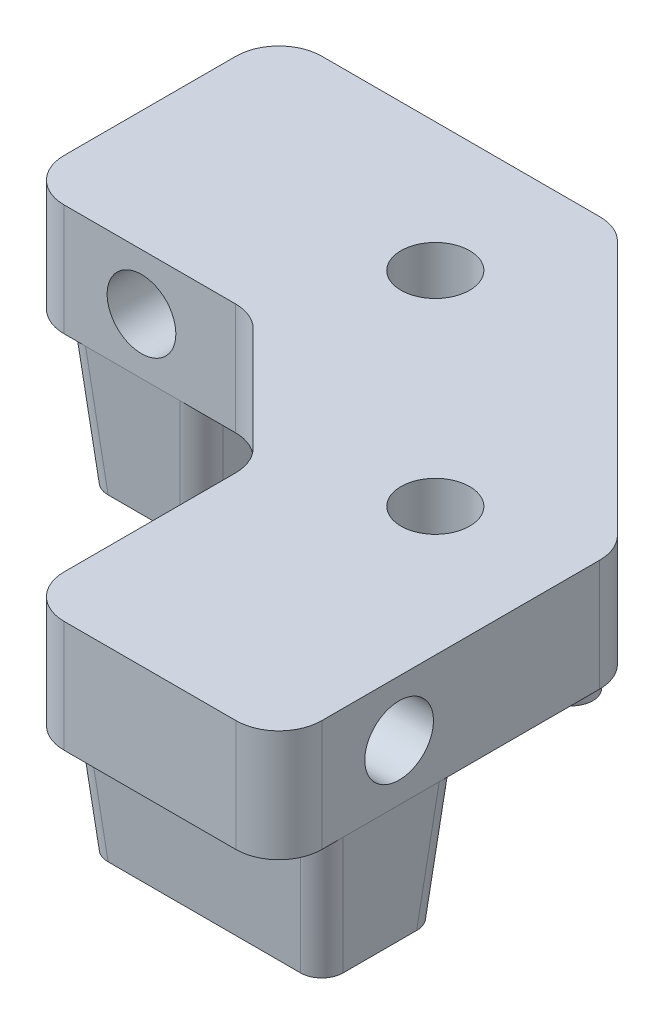
from build123d import *

# Parameters (mm, degrees)
SKETCH1_R                = 4
EXTRUDE1_DEPTH           = 13
FILLET5_R                = 5
SKETCH5_R                = 4
EXTRUDE5_DEPTH           = 30
SKETCH6_R                = 4
EXTRUDE6_DEPTH           = 30
SKETCH8_R                = 4
EXTRUDE7_DEPTH           = 30
SKETCH9_W                = 16
SKETCH9_H                = 30
EXTRUDE8_DEPTH           = 15
EXTRUDE8_DRAFT           = 5
EXTRUDE8_PROFILE_2_DEPTH = 15
EXTRUDE8_PROFILE_2_DRAFT = 5
EXTRUDE8_PROFILE_3_DEPTH = 15
EXTRUDE8_PROFILE_3_DRAFT = 5
FILLET8_R                = 2.5


with BuildPart() as part:
    # Sketch1 → Extrude1 (new body)
    with BuildSketch(Plane(origin=(0, 0, 0), x_dir=(1, 0, 0), z_dir=(0, 1, 0))):
        Polygon((0, -15), (-15, 0), (-42, 0), (-42, 30), (-2.573593129, 30), (30, -2.573593129), (30, -42), (0, -42), align=None)
        with Locations(Location((-8.786796564, 15, 0), (0, 0, 90))):
            Circle(SKETCH1_R, mode=Mode.SUBTRACT)
        with Locations(Location((15, -8.786796564, 0), (0, 0, 90))):
            Circle(SKETCH1_R, mode=Mode.SUBTRACT)
    extrude(amount=EXTRUDE1_DEPTH)

    # Fillet5
    fillet5_edges = [part.edges().sort_by_distance(p)[0] for p in [
        (-42, 6.5, 0),
        (-42, 6.5, -30),
        (-2.573593129, 6.5, -30),
        (30, 6.5, 2.573593129),
        (30, 6.5, 42),
        (0, 6.5, 42),
        (0, 6.5, 15),
        (-15, 6.5, 0),
    ]]
    fillet(fillet5_edges, radius=FILLET5_R)

    # Sketch5 → Extrude5 (cut)
    with BuildSketch(Plane(origin=(-7.5, 0, 7.5), x_dir=(0.7071067811865476, 0, 0.7071067811865476), z_dir=(-0.7071067811865476, 0, 0.7071067811865476))):
        with Locations((0, 6.5)):
            Circle(SKETCH5_R)
    extrude(amount=-EXTRUDE5_DEPTH, mode=Mode.SUBTRACT)

    # Sketch6 → Extrude6 (cut)
    with BuildSketch(Plane.XY):
        with Locations((-28, 6.5)):
            Circle(SKETCH6_R)
    extrude(amount=-EXTRUDE6_DEPTH, mode=Mode.SUBTRACT)

    # Sketch8 → Extrude7 (cut)
    with BuildSketch(Plane.ZY):
        with Locations((28, 6.5)):
            Circle(SKETCH8_R)
    extrude(amount=-EXTRUDE7_DEPTH, mode=Mode.SUBTRACT)


with BuildPart() as extrude8_tool:
    # Sketch9 → Extrude8 (with draft: the straight prism first)
    with BuildSketch(Plane.XZ):
        with Locations((-29, -15)):
            Rectangle(SKETCH9_W, SKETCH9_H)
    extrude(amount=EXTRUDE8_DEPTH)
    # Extrude8: the draft: its side faces are tilted about the plane it starts from
    extrude8_sides = [extrude8_tool.faces().sort_by_distance(p)[0] for p in [
        (-29, -7.5, -30),
        (-21, -7.5, -15),
        (-29, -7.5, 0),
        (-37, -7.5, -15),
    ]]
    draft(extrude8_sides, Plane.XZ, EXTRUDE8_DRAFT)


with BuildPart() as part_1:
    add(part.part)

    # Extrude8: add extrude8_tool
    add(extrude8_tool.part)


with BuildPart() as extrude8_profile_2_tool:
    # Sketch9 → Extrude8 profile 2 (with draft: the straight prism first)
    with BuildSketch(Plane.XZ):
        Polygon((18.662950904, -8.763455967), (-2.550252532, 12.449747468), (-12.449747468, 2.550252532), (8.763455967, -18.662950904), align=None)
    extrude(amount=EXTRUDE8_PROFILE_2_DEPTH)
    # Extrude8 profile 2: the draft: its side faces are tilted about the plane it starts from
    extrude8_profile_2_sides = [extrude8_profile_2_tool.faces().sort_by_distance(p)[0] for p in [
        (8.056349186, -7.5, 1.843145751),
        (-7.5, -7.5, 7.5),
        (-1.843145751, -7.5, -8.056349186),
        (13.713203436, -7.5, -13.713203436),
    ]]
    draft(extrude8_profile_2_sides, Plane.XZ, EXTRUDE8_PROFILE_2_DRAFT)


with BuildPart() as part_2:
    add(part_1.part)

    # Extrude8 profile 2: add extrude8_profile_2_tool
    add(extrude8_profile_2_tool.part)


with BuildPart() as extrude8_profile_3_tool:
    # Sketch9 → Extrude8 profile 3 (with draft: the straight prism first)
    with BuildSketch(Plane.XZ):
        Polygon((30, 37), (0, 37), (0, 21), (30, 20.82233047), align=None)
    extrude(amount=EXTRUDE8_PROFILE_3_DEPTH)
    # Extrude8 profile 3: the draft: its side faces are tilted about the plane it starts from
    extrude8_profile_3_sides = [extrude8_profile_3_tool.faces().sort_by_distance(p)[0] for p in [
        (15, -7.5, 37),
        (0, -7.5, 29),
        (15, -7.5, 20.911165235),
        (30, -7.5, 28.911165235),
    ]]
    draft(extrude8_profile_3_sides, Plane.XZ, EXTRUDE8_PROFILE_3_DRAFT)


with BuildPart() as part_3:
    add(part_2.part)

    # Extrude8 profile 3: add extrude8_profile_3_tool
    add(extrude8_profile_3_tool.part)

    # Fillet8
    # the kernel refuses this fillet: 2.5 mm, written as the material it takes off along each edge
    with BuildSketch(Plane(origin=(-13.211385745, 6.155764282, 2.550252532), x_dir=(0.6990853645605914, 0.08649619246092898, 0.7097873355780214), z_dir=(0.12279134661747972, -0.9924325091389671, 0))) as fillet8_piece_1_section:
        with BuildLine():
            CenterArc((FILLET8_R * 0.992432509139, -FILLET8_R), FILLET8_R, 90, 89.564769998)
            Line((-FILLET8_R * 0.00753863989878, -FILLET8_R * 0.992403876506), (0, 0))
            Line((0, 0), (FILLET8_R * 0.992432509139, 0))
        make_face()
    fillet8_piece_1 = extrude(amount=27.519784281, mode=Mode.PRIVATE)
    fillet8_piece_1 = split(fillet8_piece_1, bisect_by=Plane(origin=(-10.350961521, 0, 2.550252532), z_dir=(0, -1, 0)), keep=Keep.TOP, mode=Mode.PRIVATE)
    add(fillet8_piece_1, mode=Mode.SUBTRACT)
    with BuildSketch(Plane(origin=(-2.550252532, 6.155764282, 13.211385745), x_dir=(-0.7097873355780224, 0.08649619246092884, -0.6990853645605904), z_dir=(0, -0.9924325091389671, -0.12279134661747967))) as fillet8_piece_2_section:
        with BuildLine():
            CenterArc((FILLET8_R * 0.992432509139, FILLET8_R), FILLET8_R, 180.435230002, 89.564769998)
            Line((-FILLET8_R * 0.00753863989878, FILLET8_R * 0.992403876506), (0, 0))
            Line((0, 0), (FILLET8_R * 0.992432509139, 0))
        make_face()
    fillet8_piece_2 = extrude(amount=27.519784281, mode=Mode.PRIVATE)
    fillet8_piece_2 = split(fillet8_piece_2, bisect_by=Plane(origin=(-2.550252532, 0, 10.350961521), z_dir=(0, -1, 0)), keep=Keep.TOP, mode=Mode.PRIVATE)
    add(fillet8_piece_2, mode=Mode.SUBTRACT)
    with BuildSketch(Plane(origin=(-0.535427042, 6.119959098, 20.467734537), x_dir=(0.9962056349623634, 0.08598926801855533, -0.01342306428755091), z_dir=(0.0868304478214788, -0.9924765600716912, 0.08631773305285761))) as fillet8_piece_3_section:
        with BuildLine():
            CenterArc((FILLET8_R * 0.98661620345, FILLET8_R), FILLET8_R, 180.77198953, 89.22801047)
            Line((-FILLET8_R * 0.0132930268312, FILLET8_R * 0.986526648575), (0, 0))
            Line((0, 0), (FILLET8_R * 0.98661620345, 0))
        make_face()
    fillet8_piece_3 = extrude(amount=27.44640961, mode=Mode.PRIVATE)
    fillet8_piece_3 = split(fillet8_piece_3, bisect_by=Plane(origin=(1.478852111, 0, 22.470119813), z_dir=(0, -1, 0)), keep=Keep.TOP, mode=Mode.PRIVATE)
    add(fillet8_piece_3, mode=Mode.SUBTRACT)
    with BuildSketch(Plane(origin=(-0.53855959, 6.155764282, 37.53855959), x_dir=(-0.007567436278487758, 0.0864961924609277, -0.9962234400966146), z_dir=(0.08682659386424772, -0.9924325091389672, -0.08682659386424656))) as fillet8_piece_4_section:
        with BuildLine():
            CenterArc((FILLET8_R * 0.992432509139, FILLET8_R), FILLET8_R, 180.435230002, 89.564769998)
            Line((-FILLET8_R * 0.00753863989879, FILLET8_R * 0.992403876506), (0, 0))
            Line((0, 0), (FILLET8_R * 0.992432509139, 0))
        make_face()
    fillet8_piece_4 = extrude(amount=27.519784281, mode=Mode.PRIVATE)
    fillet8_piece_4 = split(fillet8_piece_4, bisect_by=Plane(origin=(1.484065776, 0, 35.515934224), z_dir=(0, -1, 0)), keep=Keep.TOP, mode=Mode.PRIVATE)
    add(fillet8_piece_4, mode=Mode.SUBTRACT)
    with BuildSketch(Plane(origin=(-37.53855959, 6.155764282, 0.53855959), x_dir=(0.9962234400966147, 0.08649619246092866, 0.00756743627848773), z_dir=(0.0868265938642475, -0.9924325091389671, -0.08682659386424771))) as fillet8_piece_5_section:
        with BuildLine():
            CenterArc((FILLET8_R * 0.992432509139, -FILLET8_R), FILLET8_R, 90, 89.564769998)
            Line((-FILLET8_R * 0.00753863989878, -FILLET8_R * 0.992403876506), (0, 0))
            Line((0, 0), (FILLET8_R * 0.992432509139, 0))
        make_face()
    fillet8_piece_5 = extrude(amount=27.519784281, mode=Mode.PRIVATE)
    fillet8_piece_5 = split(fillet8_piece_5, bisect_by=Plane(origin=(-35.515934224, 0, -1.484065776), z_dir=(0, -1, 0)), keep=Keep.TOP, mode=Mode.PRIVATE)
    add(fillet8_piece_5, mode=Mode.SUBTRACT)
    with BuildSketch(Plane(origin=(-37.53855959, 6.155764282, -30.53855959), x_dir=(0.9962234400966145, 0.08649619246092907, -0.007567436278487628), z_dir=(0.08682659386424792, -0.9924325091389671, 0.08682659386424772))) as fillet8_piece_6_section:
        with BuildLine():
            CenterArc((FILLET8_R * 0.992432509139, FILLET8_R), FILLET8_R, 180.435230002, 89.564769998)
            Line((-FILLET8_R * 0.00753863989877, FILLET8_R * 0.992403876506), (0, 0))
            Line((0, 0), (FILLET8_R * 0.992432509139, 0))
        make_face()
    fillet8_piece_6 = extrude(amount=27.519784281, mode=Mode.PRIVATE)
    fillet8_piece_6 = split(fillet8_piece_6, bisect_by=Plane(origin=(-35.515934224, 0, -28.515934224), z_dir=(0, -1, 0)), keep=Keep.TOP, mode=Mode.PRIVATE)
    add(fillet8_piece_6, mode=Mode.SUBTRACT)
    with BuildSketch(Plane(origin=(-20.46144041, 6.155764282, 0.53855959), x_dir=(0.007567436278484768, 0.08649619246092911, -0.9962234400966145), z_dir=(-0.0868265938642479, -0.9924325091389671, -0.08682659386424771))) as fillet8_piece_7_section:
        with BuildLine():
            CenterArc((FILLET8_R * 0.992432509139, -FILLET8_R), FILLET8_R, 90, 89.564769998)
            Line((-FILLET8_R * 0.00753863989877, -FILLET8_R * 0.992403876506), (0, 0))
            Line((0, 0), (FILLET8_R * 0.992432509139, 0))
        make_face()
    fillet8_piece_7 = extrude(amount=27.519784281, mode=Mode.PRIVATE)
    fillet8_piece_7 = split(fillet8_piece_7, bisect_by=Plane(origin=(-22.484065776, 0, -1.484065776), z_dir=(0, -1, 0)), keep=Keep.TOP, mode=Mode.PRIVATE)
    add(fillet8_piece_7, mode=Mode.SUBTRACT)
    with BuildSketch(Plane(origin=(8.763455967, 6.155764282, -19.42458918), x_dir=(-0.7097873355780235, 0.08649619246092868, 0.6990853645605893), z_dir=(0, -0.9924325091389671, 0.12279134661747969))) as fillet8_piece_8_section:
        with BuildLine():
            CenterArc((FILLET8_R * 0.992432509139, -FILLET8_R), FILLET8_R, 90, 89.564769998)
            Line((-FILLET8_R * 0.00753863989878, -FILLET8_R * 0.992403876506), (0, 0))
            Line((0, 0), (FILLET8_R * 0.992432509139, 0))
        make_face()
    fillet8_piece_8 = extrude(amount=27.519784281, mode=Mode.PRIVATE)
    fillet8_piece_8 = split(fillet8_piece_8, bisect_by=Plane(origin=(8.763455967, 0, -16.564164956), z_dir=(0, -1, 0)), keep=Keep.TOP, mode=Mode.PRIVATE)
    add(fillet8_piece_8, mode=Mode.SUBTRACT)
    with BuildSketch(Plane(origin=(30.53855959, 6.155764282, 37.53855959), x_dir=(0.0075674362784875545, 0.08649619246093003, -0.9962234400966146), z_dir=(-0.08682659386424771, -0.9924325091389671, -0.08682659386424886))) as fillet8_piece_9_section:
        with BuildLine():
            CenterArc((FILLET8_R * 0.992432509139, -FILLET8_R), FILLET8_R, 90, 89.564769998)
            Line((-FILLET8_R * 0.00753863989876, -FILLET8_R * 0.992403876506), (0, 0))
            Line((0, 0), (FILLET8_R * 0.992432509139, 0))
        make_face()
    fillet8_piece_9 = extrude(amount=27.519784281, mode=Mode.PRIVATE)
    fillet8_piece_9 = split(fillet8_piece_9, bisect_by=Plane(origin=(28.515934224, 0, 35.515934224), z_dir=(0, -1, 0)), keep=Keep.TOP, mode=Mode.PRIVATE)
    add(fillet8_piece_9, mode=Mode.SUBTRACT)
    with BuildSketch(Plane(origin=(30.541709896, 6.191772448, 20.277402896), x_dir=(-0.9962063107197006, 0.08700605966245174, -0.001712327146725053), z_dir=(-0.08682269450948527, -0.9923879393100855, 0.08733840867564902))) as fillet8_piece_10_section:
        with BuildLine():
            CenterArc((FILLET8_R * 0.998282579203, -FILLET8_R), FILLET8_R, 90, 89.90151449)
            Line((-FILLET8_R * 0.00171594349532, -FILLET8_R * 0.998281104438), (0, 0))
            Line((0, 0), (FILLET8_R * 0.998282579203, 0))
        make_face()
    fillet8_piece_10 = extrude(amount=27.593588969, mode=Mode.PRIVATE)
    fillet8_piece_10 = split(fillet8_piece_10, bisect_by=Plane(origin=(28.510705055, 0, 22.320471611), z_dir=(0, -1, 0)), keep=Keep.TOP, mode=Mode.PRIVATE)
    add(fillet8_piece_10, mode=Mode.SUBTRACT)
    with BuildSketch(Plane(origin=(-20.46144041, 6.155764282, -30.53855959), x_dir=(0.007567436278490545, 0.0864961924609286, 0.9962234400966147), z_dir=(-0.08682659386424751, -0.9924325091389671, 0.0868265938642477))) as fillet8_piece_11_section:
        with BuildLine():
            CenterArc((FILLET8_R * 0.992432509139, FILLET8_R), FILLET8_R, 180.435230002, 89.564769998)
            Line((-FILLET8_R * 0.00753863989878, FILLET8_R * 0.992403876506), (0, 0))
            Line((0, 0), (FILLET8_R * 0.992432509139, 0))
        make_face()
    fillet8_piece_11 = extrude(amount=27.519784281, mode=Mode.PRIVATE)
    fillet8_piece_11 = split(fillet8_piece_11, bisect_by=Plane(origin=(-22.484065776, 0, -28.515934224), z_dir=(0, -1, 0)), keep=Keep.TOP, mode=Mode.PRIVATE)
    add(fillet8_piece_11, mode=Mode.SUBTRACT)
    with BuildSketch(Plane(origin=(19.42458918, 6.155764282, -8.763455967), x_dir=(-0.6990853645605911, 0.08649619246092893, 0.7097873355780219), z_dir=(-0.1227913466174797, -0.9924325091389671, 0))) as fillet8_piece_12_section:
        with BuildLine():
            CenterArc((FILLET8_R * 0.992432509139, FILLET8_R), FILLET8_R, 180.435230002, 89.564769998)
            Line((-FILLET8_R * 0.00753863989878, FILLET8_R * 0.992403876506), (0, 0))
            Line((0, 0), (FILLET8_R * 0.992432509139, 0))
        make_face()
    fillet8_piece_12 = extrude(amount=27.519784281, mode=Mode.PRIVATE)
    fillet8_piece_12 = split(fillet8_piece_12, bisect_by=Plane(origin=(16.564164956, 0, -8.763455967), z_dir=(0, -1, 0)), keep=Keep.TOP, mode=Mode.PRIVATE)
    add(fillet8_piece_12, mode=Mode.SUBTRACT)


solid = part_3.part
